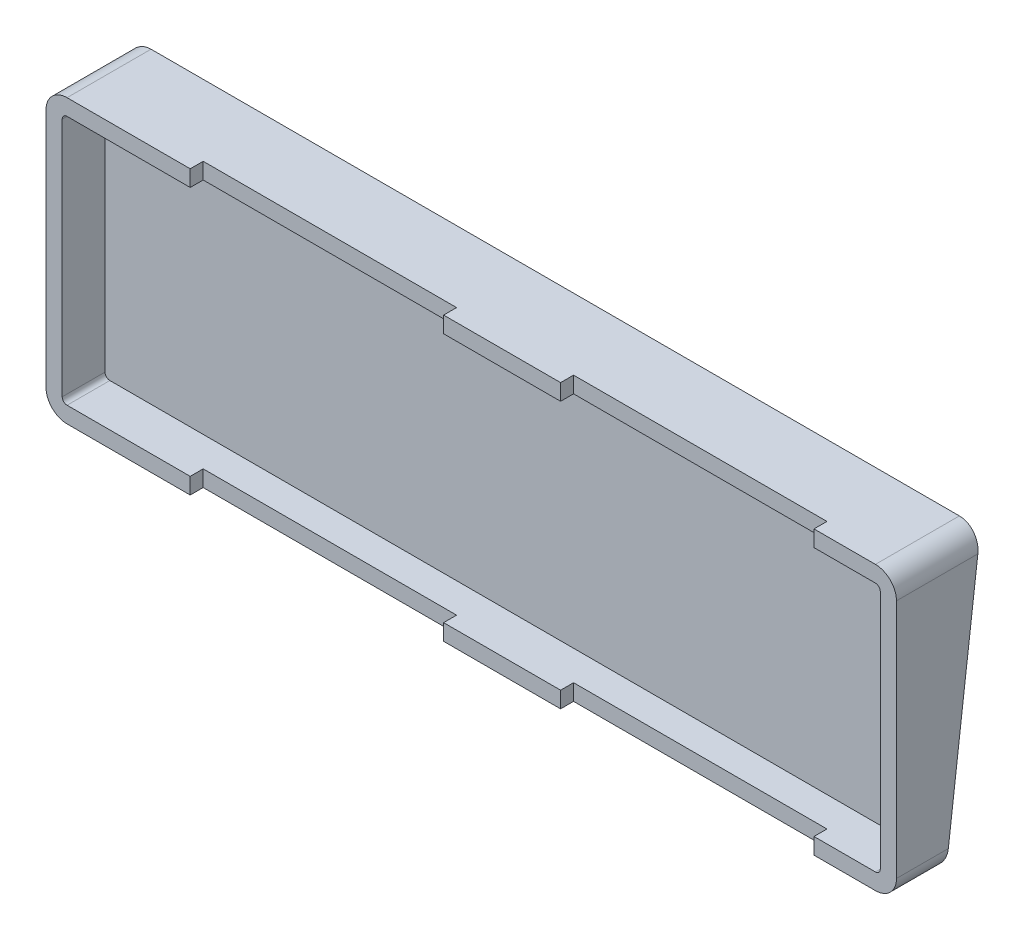
from build123d import *

# Parameters (mm, degrees)
MAIN_CASE_OUTLINE_DEPTH      = 6.02
MAIN_CASE_OUTLINE_DEPTH_BACK = 6.185
SKETCH2_W                    = 78.2
SKETCH2_H                    = 5
GASKET_CUTOUTS_DEPTH         = 4
MAKE_START                   = -9.185
MAKE_ROOM_FOR_BATTERY_DEPTH  = 3
SOLIDIFY_BOTTOM_DEPTH        = 2
MOVE_FACE2_BY                = 15


# Read off the part's stored shape, not the designer's step: Make Room for Battery
with BuildPart() as part:
    # Sketch1 → Main Case Outline (new, two sides: drawn at the far end of the back side and taken through both)
    with BuildSketch(Plane.XY.offset(-MAIN_CASE_OUTLINE_DEPTH_BACK)):
        with BuildLine():
            Line((274.272499626, -45.935), (24.8125, -45.935))
            ThreePointArc((24.8125, -45.935), (20.216304251, -47.838807156), (18.3125, -52.435004109))
            Line((18.3125, -52.435004109), (18.3125, -126.635))
            ThreePointArc((18.3125, -126.635), (20.216307156, -131.231195749), (24.812504109, -133.135))
            Line((24.812504109, -133.135), (274.2725, -133.135))
            ThreePointArc((274.2725, -133.135), (278.868695177, -131.231193416), (280.7725, -126.63499751))
            Line((280.7725, -126.63499751), (280.7725, -52.435))
            ThreePointArc((280.7725, -52.435), (278.868694164, -47.838805571), (274.272499626, -45.935))
        make_face()
        with BuildLine():
            Line((275.7725, -126.635), (275.7725, -52.435))
            ThreePointArc((275.7725, -52.435), (275.333160259, -51.374339477), (274.272499626, -50.935))
            Line((274.272499626, -50.935), (24.8125, -50.935))
            ThreePointArc((24.8125, -50.935), (23.751839477, -51.374339741), (23.3125, -52.435000374))
            Line((23.3125, -52.435000374), (23.3125, -126.635))
            ThreePointArc((23.3125, -126.635), (23.751839741, -127.695660523), (24.812500374, -128.135))
            Line((24.812500374, -128.135), (274.2725, -128.135))
            ThreePointArc((274.2725, -128.135), (275.333160391, -127.695660391), (275.7725, -126.635))
        make_face(mode=Mode.SUBTRACT)
    extrude(amount=MAIN_CASE_OUTLINE_DEPTH + MAIN_CASE_OUTLINE_DEPTH_BACK)

    # Sketch2 → Gasket Cutouts (cut)
    with BuildSketch(Plane.XY.offset(6.02)):
        with Locations((101.9175, -130.635)):
            Rectangle(SKETCH2_W, SKETCH2_H)
        with Locations((216.2175, -130.635)):
            Rectangle(SKETCH2_W, SKETCH2_H)
        with Locations((101.9175, -48.435)):
            Rectangle(SKETCH2_W, SKETCH2_H)
        with Locations((216.2175, -48.435)):
            Rectangle(SKETCH2_W, SKETCH2_H)
    extrude(amount=-GASKET_CUTOUTS_DEPTH, mode=Mode.SUBTRACT)

    # Make Room for Battery outline → Make Room for Battery (add)
    with BuildSketch(Plane.XY.offset(MAKE_START)):
        with BuildLine():
            Line((280.7725, -126.63499751), (280.7725, -52.435))
            ThreePointArc((280.7725, -52.435), (278.868694164, -47.838805571), (274.272499626, -45.935))
            Line((274.272499626, -45.935), (24.8125, -45.935))
            ThreePointArc((24.8125, -45.935), (20.216304251, -47.838807156), (18.3125, -52.435004109))
            Line((18.3125, -52.435004109), (18.3125, -126.635))
            ThreePointArc((18.3125, -126.635), (20.216307156, -131.231195749), (24.812504109, -133.135))
            Line((24.812504109, -133.135), (274.2725, -133.135))
            ThreePointArc((274.2725, -133.135), (278.868695177, -131.231193416), (280.7725, -126.63499751))
        make_face()
        with BuildLine():
            ThreePointArc((275.7725, -126.635), (275.333160391, -127.695660391), (274.2725, -128.135))
            Line((274.2725, -128.135), (24.812500374, -128.135))
            ThreePointArc((24.812500374, -128.135), (23.751839741, -127.695660523), (23.3125, -126.635))
            Line((23.3125, -126.635), (23.3125, -52.435000374))
            ThreePointArc((23.3125, -52.435000374), (23.751839477, -51.374339741), (24.8125, -50.935))
            Line((24.8125, -50.935), (274.272499626, -50.935))
            ThreePointArc((274.272499626, -50.935), (275.333160259, -51.374339477), (275.7725, -52.435))
            Line((275.7725, -52.435), (275.7725, -126.635))
        make_face(mode=Mode.SUBTRACT)
    extrude(amount=MAKE_ROOM_FOR_BATTERY_DEPTH)

    # Sketch3 → Solidify Bottom (add)
    with BuildSketch(Plane(origin=(0, 0, -9.185), x_dir=(-1, 0, 0), z_dir=(0, 0, -1))):
        with BuildLine():
            Line((-280.7725, -52.435), (-280.7725, -126.63499751))
            ThreePointArc((-280.7725, -126.63499751), (-278.868695177, -131.231193416), (-274.2725, -133.135))
            Line((-274.2725, -133.135), (-24.812504109, -133.135))
            ThreePointArc((-24.812504109, -133.135), (-20.216307156, -131.231195749), (-18.3125, -126.635))
            Line((-18.3125, -126.635), (-18.3125, -52.435004109))
            ThreePointArc((-18.3125, -52.435004109), (-20.216304251, -47.838807156), (-24.8125, -45.935))
            Line((-24.8125, -45.935), (-274.272499626, -45.935))
            ThreePointArc((-274.272499626, -45.935), (-278.868694164, -47.838805571), (-280.7725, -52.435))
        make_face()
    extrude(amount=-SOLIDIFY_BOTTOM_DEPTH)

    # Move Face2: a face moved outward by 15.0
    extrude(part.faces().sort_by_distance((149.5425, -89.535, -9.185))[0], amount=MOVE_FACE2_BY, dir=(0, 0, -1))

    # Cut Bottom Face to Angle
    split(bisect_by=Plane(origin=(0, -3.088365547, -25.152718908), x_dir=(-1, 0, 0), z_dir=(2.5491867248569473e-15, -0.12186934340514763, -0.992546151641322)), keep=Keep.BOTTOM)


solid = part.part
